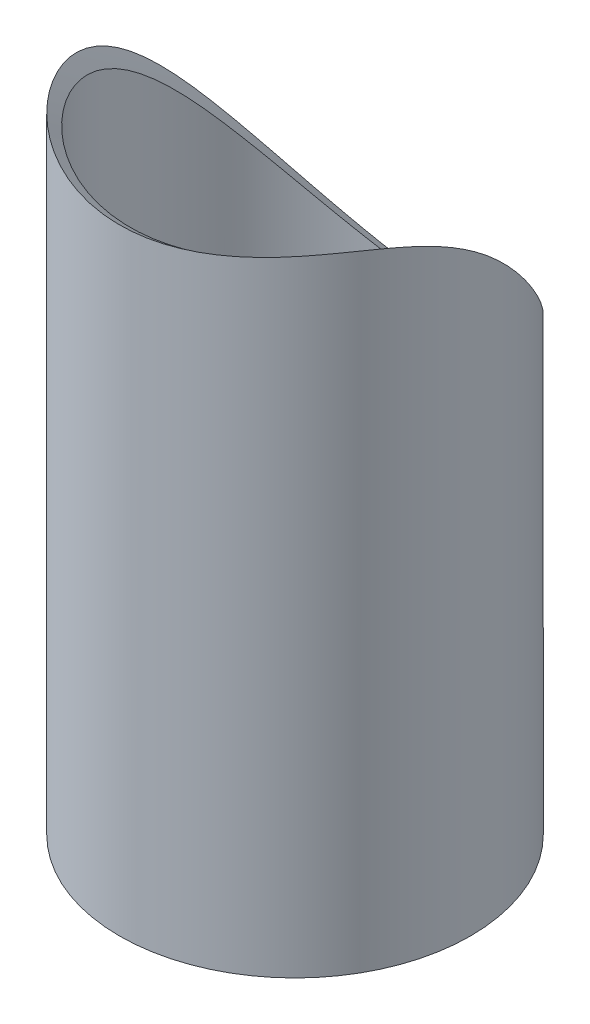
from build123d import *

# Parameters (mm, degrees)
EXTRUDE_1_OUTLINE_R      = 50
EXTRUDE_1_OUTLINE_R_2    = 47
EXTRUDE_1_DEPTH          = 200
CUT_EXTRUDE_1_DEPTH      = 213.132034356
CUT_EXTRUDE_1_DEPTH_BACK = 213.132034356
SKETCH_2_R               = 65


# Read off the part's stored shape, not the designer's step: Вытянуть-Тонкостенный1
with BuildPart() as part:
    # Вытянуть-Тонкостенный1 outline → Вытянуть-Тонкостенный1 (new body)
    with BuildSketch(Plane(origin=(0, 0, 0), x_dir=(1, 0, 0), z_dir=(0, 1, 0))):
        Circle(EXTRUDE_1_OUTLINE_R)
        Circle(EXTRUDE_1_OUTLINE_R_2, mode=Mode.SUBTRACT)
    extrude(amount=EXTRUDE_1_DEPTH)

    # Эскиз2 → Вырез-Вытянуть1 (cut, two sides: drawn at the far end of the back side and taken through both)
    with BuildSketch(Plane(origin=(0, 0, 0), x_dir=(1, 0, 0), z_dir=(0, -0.5735764363510444, -0.819152044288993)).offset(-CUT_EXTRUDE_1_DEPTH_BACK)):
        with Locations((0, -180)):
            Circle(SKETCH_2_R)
    extrude(amount=CUT_EXTRUDE_1_DEPTH + CUT_EXTRUDE_1_DEPTH_BACK, mode=Mode.SUBTRACT)


solid = part.part
